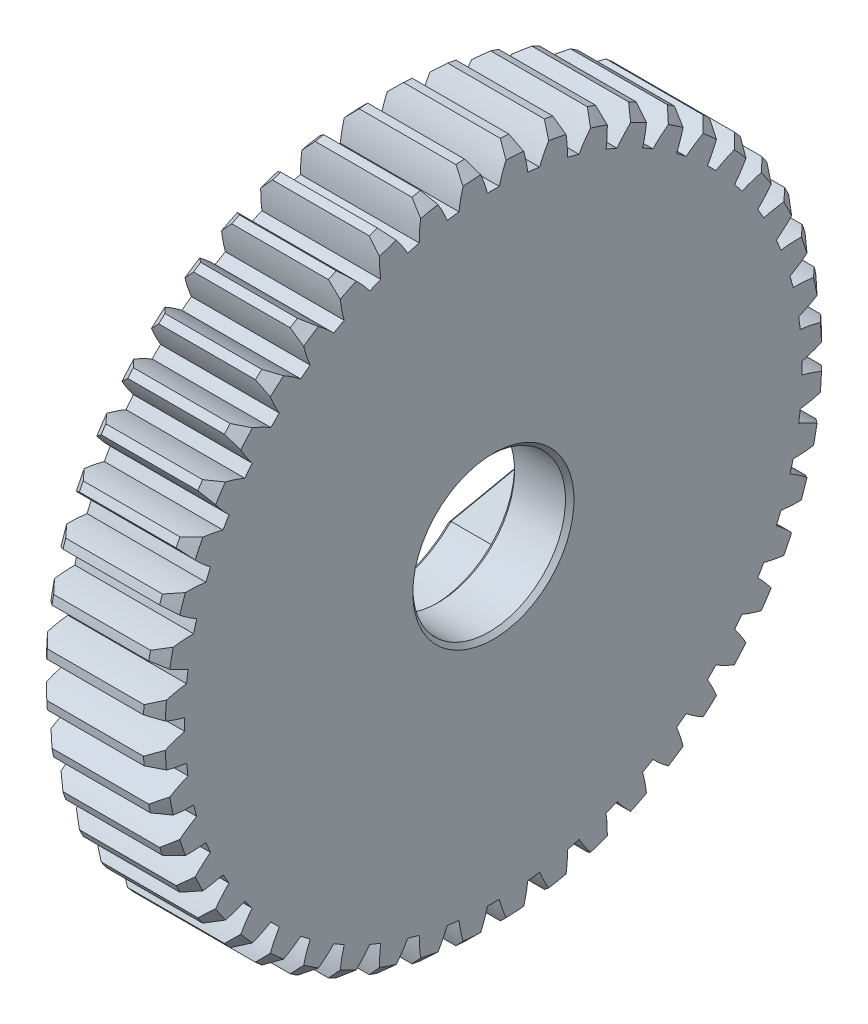
from build123d import *

# Parameters (mm, degrees)
BASPROSKE_W                = 7
BASPROSKE_H                = 20
TOOTHCUT_DEPTH             = 30.137604569
TEETHCUTS_COUNT            = 48
TEETHCUTS_ANGLE            = 352.5
BORSKE_R                   = 2.5
BORE_DEPTH                 = 50.0000508
SZKIC2_R                   = 4.5
WYTNIJ_WYCI_GNI_CIE1_DEPTH = 30.099360137
WYTNIJ_WYCI_GNI_CIE2_DEPTH = 3.5
SZYK_KO_OWY1_COUNT         = 2
SFAZOWANIE1_SIZE           = 0.25
WYTNIJ_WYCI_GNI_CIE3_DEPTH = 1
SZYK_KO_OWY2_COUNT         = 2


with BuildPart() as part:
    # BasProSke → Base-Revolve (revolve)
    with BuildSketch(Plane(origin=(0, 0, 0), x_dir=(1, 0, 0), z_dir=(0, 1, 0))):
        with Locations((3.5, 10)):
            Rectangle(BASPROSKE_W, BASPROSKE_H)
    revolve(axis=Axis((-10, 0, 0), (1, 0, 0)))

    # TooCutSke → ToothCut (cut, through all)
    with BuildSketch(Plane(origin=(0, 0, 0), x_dir=(0, 0, -1), z_dir=(1, 0, 0))):
        with BuildLine():
            ThreePointArc((0.350900353, 18.195616778), (0, 18.199), (-0.350900353, 18.195616778))
            ThreePointArc((-0.350900353, 18.195616778), (-0.652831518, 19.118985912), (-1.068914604, 19.99685142))
            ThreePointArc((-1.068914604, 19.99685142), (0, 20.0254), (1.068914604, 19.99685142))
            ThreePointArc((1.068914604, 19.99685142), (0.652831518, 19.118985912), (0.350900353, 18.195616778))
        make_face()
    toothcut = extrude(amount=TOOTHCUT_DEPTH, mode=Mode.SUBTRACT)

    # TeethCuts: ToothCut ×48 about axis
    teethcuts_axis = Axis((-10, 0, 0), (1, 0, 0))
    for i in range(1, TEETHCUTS_COUNT):
        add(toothcut.rotate(teethcuts_axis, i * TEETHCUTS_ANGLE / (TEETHCUTS_COUNT - 1)), mode=Mode.SUBTRACT)

    # BorSke → Bore (cut, symmetric)
    with BuildSketch(Plane(origin=(0, 0, 0), x_dir=(0, 0, -1), z_dir=(1, 0, 0))):
        Circle(BORSKE_R)
    extrude(amount=BORE_DEPTH, both=True, mode=Mode.SUBTRACT)

    # Szkic1 → Wycięcie-obrót1 (revolve, cut)
    with BuildSketch(Plane.XY):
        Polygon((0, -20.350900353), (1, -20.350900353), (0, -19.350900353), align=None)
    wyci_cie_obr_t1 = revolve(axis=Axis((7, 0, 0), (-1, 0, 0)), mode=Mode.SUBTRACT)

    # Lustro1: Wycięcie-obrót1 across plane
    add(wyci_cie_obr_t1.mirror(Plane(origin=(3.5, 0, 0), x_dir=(0, 0, 1), z_dir=(1, 0, 0))), mode=Mode.SUBTRACT)

    # Szkic2 → Wytnij-wyciągnięcie1 (cut, through all)
    with BuildSketch(Plane.ZY):
        Circle(SZKIC2_R)
    extrude(amount=-WYTNIJ_WYCI_GNI_CIE1_DEPTH, mode=Mode.SUBTRACT)

    # Szkic3 → Wytnij-wyciągnięcie2 (cut)
    with BuildSketch(Plane.ZY):
        with BuildLine():
            Line((-3.66581575, 4.749925777), (-14.775995634, 3.908695342))
            Line((-14.775995634, 3.908695342), (-15.159772063, -1.946601465))
            Line((-15.159772063, -1.946601465), (-4.254443913, -4.230804532))
            ThreePointArc((-4.254443913, -4.230804532), (5.987153539, -0.392418775), (-3.66581575, 4.749925777))
        make_face()
    wytnij_wyci_gni_cie2 = extrude(amount=-WYTNIJ_WYCI_GNI_CIE2_DEPTH, mode=Mode.SUBTRACT)

    # Szyk kołowy1: Wytnij-wyciągnięcie2 ×2 about axis
    szyk_ko_owy1_axis = Axis((7, 0, 0), (-1, 0, 0))
    for i in range(1, SZYK_KO_OWY1_COUNT):
        add(wytnij_wyci_gni_cie2.rotate(szyk_ko_owy1_axis, i * 360 / SZYK_KO_OWY1_COUNT), mode=Mode.SUBTRACT)

    # Sfazowanie1
    sfazowanie1_edges = [part.edges().sort_by_distance(p)[0] for p in [
        (3.5, 0, -4.5),
        (7, 0, -4.5),
        (0, -0.981046938, 14.967883849),
        (0, 3.088702999, 9.707107988),
        (0, -4.329310559, 9.220905692),
        (0, -5.987153539, -0.392418775),
        (0, 5.987153539, 0.392418775),
        (0, 4.329310559, -9.220905692),
        (0, 0.981046938, -14.967883849),
        (0, -3.088702999, -9.707107988),
    ]]
    chamfer(sfazowanie1_edges, length=SFAZOWANIE1_SIZE)

    # Szkic4 → Wytnij-wyciągnięcie3 (cut)
    with BuildSketch(Plane.ZY):
        Polygon((-17.961460618, 1.177256326), (-16.530075363, 0.081292709), (-16.399269104, 2.077010556), align=None)
    wytnij_wyci_gni_cie3 = extrude(amount=-WYTNIJ_WYCI_GNI_CIE3_DEPTH, mode=Mode.SUBTRACT)

    # Szyk kołowy2: Wytnij-wyciągnięcie3 ×2 about axis
    szyk_ko_owy2_axis = Axis((7, 0, 0), (-1, 0, 0))
    for i in range(1, SZYK_KO_OWY2_COUNT):
        add(wytnij_wyci_gni_cie3.rotate(szyk_ko_owy2_axis, i * 360 / SZYK_KO_OWY2_COUNT), mode=Mode.SUBTRACT)


solid = part.part
